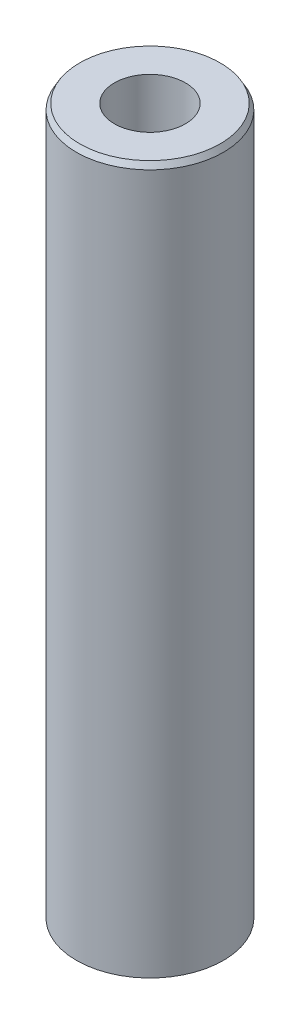
from build123d import *
from OCP.BRepFilletAPI import BRepFilletAPI_MakeChamfer

# Parameters (mm, degrees)
SKETCH1_R           = 60
BOSS_EXTRUDE1_DEPTH = 578.592608692
SKETCH2_R           = 28.998425196
CUT_EXTRUDE1_DEPTH  = 585.781503497
CHAMFER1_SIZE       = 4.642875058
CHAMFER1_SIZE2      = 2.680565164


with BuildPart() as part:
    # Sketch1 → Boss-Extrude1 (new body)
    with BuildSketch(Plane(origin=(0, 0, 0), x_dir=(1, 0, 0), z_dir=(0, 1, 0))):
        Circle(SKETCH1_R)
    extrude(amount=BOSS_EXTRUDE1_DEPTH)

    # Sketch2 → Cut-Extrude1 (cut, through all)
    with BuildSketch(Plane(origin=(0, 0, 0), x_dir=(1, 0, 0), z_dir=(0, 1, 0))):
        Circle(SKETCH2_R)
    extrude(amount=CUT_EXTRUDE1_DEPTH, mode=Mode.SUBTRACT)

    # Chamfer1: one chamfer whose edges measure the first distance from different faces: ONE call of the kernel's chamfer builder (chamfer() names one face for all edges)
    chamfer1_edges_1 = [part.edges().sort_by_distance(p)[0] for p in [
        (-60, 578.592608692, 0),
    ]]
    chamfer1_side_1 = [part.faces().sort_by_distance(p)[0] for p in [
        (-60, 289.296304346, 0),
    ]]
    chamfer1_edges_2 = [part.edges().sort_by_distance(p)[0] for p in [
        (-60, 0, 0),
    ]]
    chamfer1_side_2 = [part.faces().sort_by_distance(p)[0] for p in [
        (-58.302943725, 0, 0),
    ]]
    chamfer1 = BRepFilletAPI_MakeChamfer(part.part.solid().wrapped)
    for e in chamfer1_edges_1:
        chamfer1.Add(CHAMFER1_SIZE, CHAMFER1_SIZE2, e.wrapped, chamfer1_side_1[0].wrapped)  # the first distance lies on this face
    for e in chamfer1_edges_2:
        chamfer1.Add(CHAMFER1_SIZE, CHAMFER1_SIZE2, e.wrapped, chamfer1_side_2[0].wrapped)  # the first distance lies on this face
    add(Compound.cast(chamfer1.Shape()), mode=Mode.REPLACE)


solid = part.part
